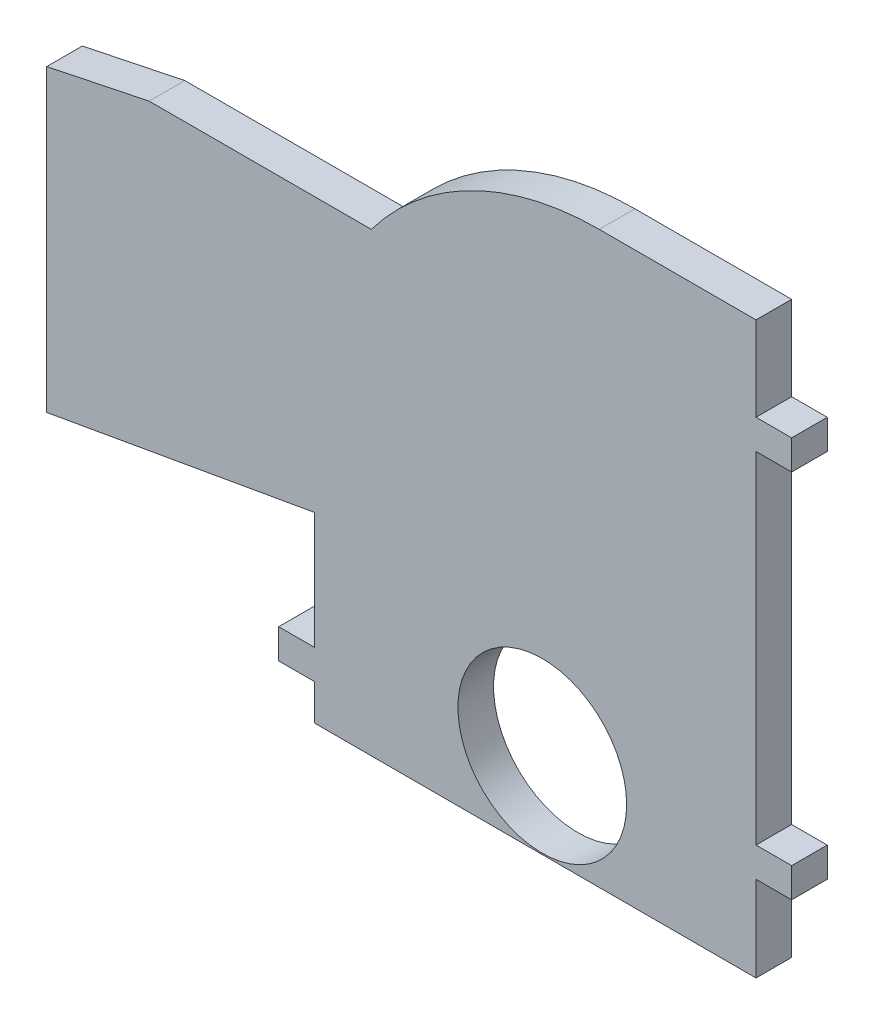
from build123d import *

# Parameters (mm, degrees)
SKETCH1_R           = 3.7592
BOSS_EXTRUDE1_DEPTH = 1.5875


with BuildPart() as part:
    # Sketch1 → Boss-Extrude1 (new body)
    with BuildSketch(Plane.XY):
        with BuildLine():
            Line((-22.084921519, 2.212007412), (-10.16, 4.318))
            Line((-10.16, 4.318), (-10.16, -0.889))
            Line((-10.16, -0.889), (-11.7475, -0.889))
            Line((-11.7475, -0.889), (-11.7475, -2.2098))
            Line((-11.7475, -2.2098), (-10.16, -2.2098))
            Line((-10.16, -2.2098), (-10.16, -3.81))
            Line((-10.16, -3.81), (9.525, -3.81))
            Line((9.525, -3.81), (9.525, 0))
            Line((9.525, 0), (11.1125, 0))
            Line((11.1125, 0), (11.1125, 1.3208))
            Line((11.1125, 1.3208), (9.525, 1.3208))
            Line((9.525, 1.3208), (9.525, 16.51))
            Line((9.525, 16.51), (11.1125, 16.51))
            Line((11.1125, 16.51), (11.1125, 17.8308))
            Line((11.1125, 17.8308), (9.525, 17.8308))
            Line((9.525, 17.8308), (9.525, 21.59))
            Line((9.525, 21.59), (2.54, 21.59))
            ThreePointArc((2.54, 21.59), (-3.139612663, 20.249225326), (-7.62, 16.51))
            Line((-7.62, 16.51), (-17.51946076, 16.51))
            Line((-17.51946076, 16.51), (-22.084921519, 15.561162564))
            Line((-22.084921519, 15.561162564), (-22.084921519, 2.212007412))
        make_face()
        Circle(SKETCH1_R, mode=Mode.SUBTRACT)
    extrude(amount=BOSS_EXTRUDE1_DEPTH)


solid = part.part
